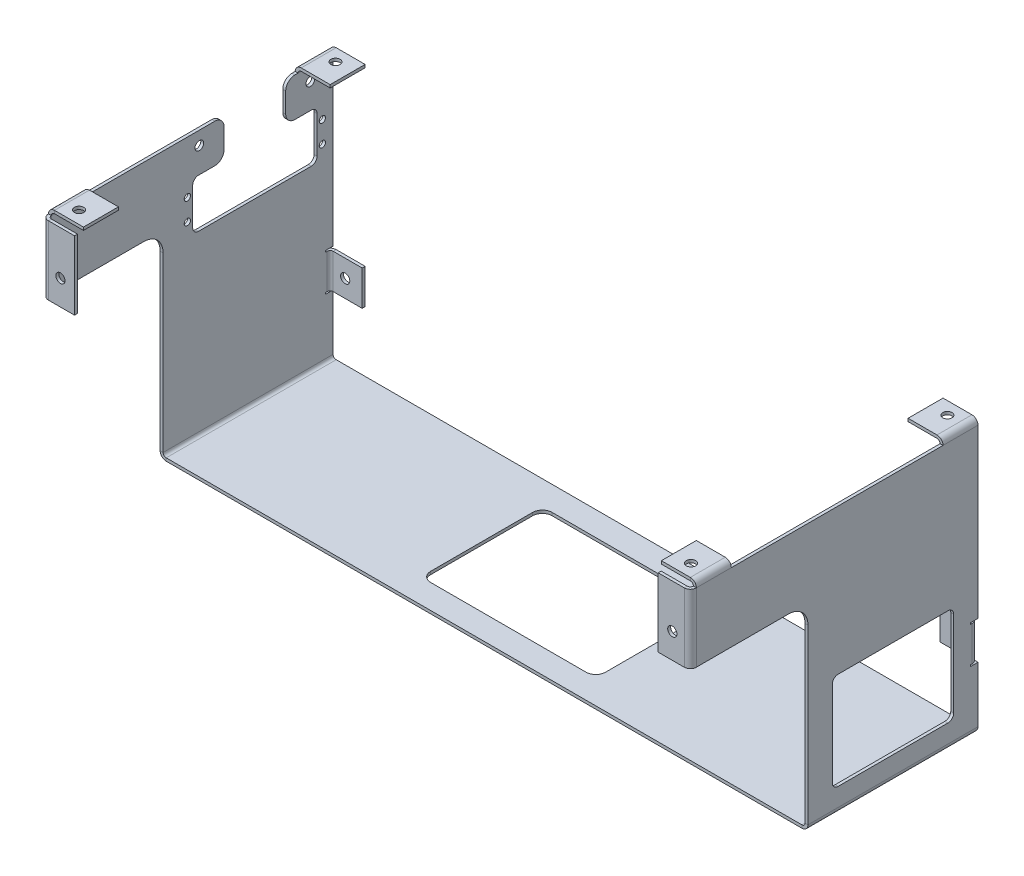
from build123d import *

# Parameters (mm, degrees)
BASE_FLANGE1_DEPTH              = 3.03784
EDGE_FLANGE2_DEPTH              = 175
EDGE_FLANGE3_STRIP_W            = 18.50136
EDGE_FLANGE3_STRIP_H            = 3.03784
EDGE_FLANGE3_STRIP_CUT_DEPTH    = 175
EDGE_FLANGE3_DEPTH              = 175
EDGE_FLANGE3_FLAT_DEPTH         = 3.03784
FILLET1_R                       = 20
EDGE_FLANGE6_STRIP_W            = 18.50136
EDGE_FLANGE6_STRIP_H            = 3.03784
EDGE_FLANGE6_STRIP_CUT_DEPTH    = 290
EDGE_FLANGE6_STRIP_2_W          = 18.50136
EDGE_FLANGE6_STRIP_2_H          = 3.03784
EDGE_FLANGE6_STRIP_CUT_2_DEPTH  = 290
EDGE_FLANGE6_DEPTH              = 290
EDGE_FLANGE6_BEND_DEPTH         = 290
SKETCH38_W                      = 218
SKETCH38_H                      = 6.21284
CUT_EXTRUDE1_DEPTH              = 778.569289517
EDGE_FLANGE7_STRIP_W            = 18.50136
EDGE_FLANGE7_STRIP_H            = 3.03784
EDGE_FLANGE7_STRIP_CUT_DEPTH    = 36
EDGE_FLANGE7_RELIEF_W           = 20.02028
EDGE_FLANGE7_RELIEF_H           = 1.51892
EDGE_FLANGE7_RELIEF_CUT_DEPTH   = 3.03784
EDGE_FLANGE7_STRIP_2_W          = 18.50136
EDGE_FLANGE7_STRIP_2_H          = 3.03784
EDGE_FLANGE7_STRIP_CUT_2_DEPTH  = 36
EDGE_FLANGE7_RELIEF_2_W         = 20.02028
EDGE_FLANGE7_RELIEF_2_H         = 1.51892
EDGE_FLANGE7_RELIEF_CUT_2_DEPTH = 3.03784
EDGE_FLANGE7_DEPTH              = 36
EDGE_FLANGE7_BEND_DEPTH         = 36
EDGE_FLANGE8_DEPTH              = 70.78716
EDGE_FLANGE8_BEND_DEPTH         = 70.78716
F_9_5_9_5_DIAMETER_HOLE1_D      = 9.5
F_9_5_9_5_DIAMETER_HOLE1_DEPTH  = 3.03784
F_9_5_9_5_DIAMETER_HOLE2_D      = 9.5
CUT_EXTRUDE2_DEPTH              = 778.31126101
M5_CLEARANCE_HOLE1_D            = 6.5
M5_CLEARANCE_HOLE1_DEPTH        = 3.03784
CUT_EXTRUDE3_REACH              = 781.908
F_9_5_9_5_DIAMETER_HOLE3_D      = 9.5
CUT_EXTRUDE4_DEPTH              = 779.440188529
CUT_EXTRUDE5_REACH              = 781.908
SKETCH62_W                      = 63.5
SKETCH62_H                      = 39.78716
FILLET2_R                       = 9.525
M8_CLEARANCE_HOLE1_D            = 9
M8_CLEARANCE_HOLE1_DEPTH        = 3.03784


# Sheet-metal steps are written as plain solids
with BuildPart() as part:
    # Sketch1 → Base-Flange1 (new body)
    with BuildSketch(Plane(origin=(0, 0, 0), x_dir=(0, 0, -1), z_dir=(1, 0, 0))):
        Polygon((-175, 198), (-290, 198), (-290, 275), (0, 275), (0, 0), (-175, 0), align=None)
    extrude(amount=-BASE_FLANGE1_DEPTH)

    # Edge-Flange2 section (across the edge) → Edge-Flange2 (add)
    with BuildSketch(Plane(origin=(0, -3.175, 175), x_dir=(0, 1, 0), z_dir=(0, 0, -1))):
        with BuildLine():
            Line((-3.03784, 3.175), (-3.03784, 663.96216))
            Line((-3.03784, 663.96216), (0, 663.96216))
            Line((0, 663.96216), (0, 3.175))
            ThreePointArc((0, 3.175), (0.92993597, 0.92993597), (3.175, 0))
            Line((3.175, 0), (3.175, -3.03784))
            ThreePointArc((3.175, -3.03784), (-1.218141294, -1.218141294), (-3.03784, 3.175))
        make_face()
    extrude(amount=EDGE_FLANGE2_DEPTH)

    # Edge-Flange3 strip (across the edge) → Edge-Flange3 strip cut (cut)
    with BuildSketch(Plane(origin=(663.96216, -3.175, 175), x_dir=(-1, 0, 0), z_dir=(0, 0, -1))):
        with Locations((-3.03784, -1.51892)):
            Rectangle(EDGE_FLANGE3_STRIP_W, EDGE_FLANGE3_STRIP_H)
    extrude(amount=EDGE_FLANGE3_STRIP_CUT_DEPTH, mode=Mode.SUBTRACT)

    # Edge-Flange3 bend section (across the edge) → Edge-Flange3 (add)
    with BuildSketch(Plane(origin=(663.96216, -3.175, 175), x_dir=(-1, 0, 0), z_dir=(0, 0, -1))):
        with BuildLine():
            Line((0, 3.175), (3.03784, 3.175))
            ThreePointArc((3.03784, 3.175), (3.96777597, 0.92993597), (6.21284, 0))
            Line((6.21284, 0), (6.21284, -3.03784))
            ThreePointArc((6.21284, -3.03784), (1.819698706, -1.218141294), (0, 3.175))
        make_face()
    extrude(amount=EDGE_FLANGE3_DEPTH)

    # Edge-Flange3 profile (on flange) → Edge-Flange3 flat (add)
    with BuildSketch(Plane(origin=(663.96216, -3.175, 0), x_dir=(0, 0, -1), z_dir=(1, 0, 0))):
        Polygon((0, 3.175), (0, 278.175), (-290, 278.175), (-290, 201.175), (-175, 201.175), (-175, 3.175), align=None)
    extrude(amount=-EDGE_FLANGE3_FLAT_DEPTH)

    # Fillet1
    fillet1_edges = [part.edges().sort_by_distance(p)[0] for p in [
        (-1.51892, 198, 175),
        (662.44324, 198, 175),
    ]]
    fillet(fillet1_edges, radius=FILLET1_R)

    # Edge-Flange6 strip (across the edge) → Edge-Flange6 strip cut (cut)
    with BuildSketch(Plane(origin=(0, 275, 0), x_dir=(0, -1, 0), z_dir=(0, 0, 1))):
        with Locations((-3.03784, -1.51892)):
            Rectangle(EDGE_FLANGE6_STRIP_W, EDGE_FLANGE6_STRIP_H)
    extrude(amount=EDGE_FLANGE6_STRIP_CUT_DEPTH, mode=Mode.SUBTRACT)

    # Edge-Flange6 strip 2 (across the edge) → Edge-Flange6 strip cut 2 (cut)
    with BuildSketch(Plane(origin=(660.92432, 275, 290), x_dir=(0, -1, 0), z_dir=(0, 0, -1))):
        with Locations((-3.03784, -1.51892)):
            Rectangle(EDGE_FLANGE6_STRIP_2_W, EDGE_FLANGE6_STRIP_2_H)
    extrude(amount=EDGE_FLANGE6_STRIP_CUT_2_DEPTH, mode=Mode.SUBTRACT)

    # Edge-Flange6 section (across the edge) → Edge-Flange6 (add)
    with BuildSketch(Plane(origin=(0, 275, 0), x_dir=(0, -1, 0), z_dir=(0, 0, 1))):
        with BuildLine():
            Line((0, 3.175), (0, 32.96216))
            Line((0, 32.96216), (3.03784, 32.96216))
            Line((3.03784, 32.96216), (3.03784, 3.175))
            ThreePointArc((3.03784, 3.175), (3.96777597, 0.92993597), (6.21284, 0))
            Line((6.21284, 0), (6.21284, -3.03784))
            ThreePointArc((6.21284, -3.03784), (1.819698706, -1.218141294), (0, 3.175))
        make_face()
    extrude(amount=EDGE_FLANGE6_DEPTH)

    # Edge-Flange6 section 2 (across the edge) → Edge-Flange6 bend (add)
    with BuildSketch(Plane(origin=(660.92432, 275, 290), x_dir=(0, -1, 0), z_dir=(0, 0, -1))):
        with BuildLine():
            Line((0, 3.175), (0, 32.96216))
            Line((0, 32.96216), (3.03784, 32.96216))
            Line((3.03784, 32.96216), (3.03784, 3.175))
            ThreePointArc((3.03784, 3.175), (3.96777597, 0.92993597), (6.21284, 0))
            Line((6.21284, 0), (6.21284, -3.03784))
            ThreePointArc((6.21284, -3.03784), (1.819698706, -1.218141294), (0, 3.175))
        make_face()
    extrude(amount=EDGE_FLANGE6_BEND_DEPTH)

    # Sketch38 → Cut-Extrude1 (cut, through all)
    with BuildSketch(Plane(origin=(663.96216, 0, 0), x_dir=(0, 0, -1), z_dir=(1, 0, 0))):
        with Locations((-145, 271.89358)):
            Rectangle(SKETCH38_W, SKETCH38_H)
    extrude(amount=-CUT_EXTRUDE1_DEPTH, mode=Mode.SUBTRACT)

    # Edge-Flange7 strip (across the edge) → Edge-Flange7 strip cut (cut)
    with BuildSketch(Plane.ZX.offset(59)):
        with Locations((-3.03784, -1.51892)):
            Rectangle(EDGE_FLANGE7_STRIP_W, EDGE_FLANGE7_STRIP_H)
    extrude(amount=EDGE_FLANGE7_STRIP_CUT_DEPTH, mode=Mode.SUBTRACT)

    # Edge-Flange7 relief (on the sheet) → Edge-Flange7 relief cut (cut)
    with BuildSketch(Plane(origin=(0, 59, 6.21284), x_dir=(0, 0, 1), z_dir=(1, 0, 0))):
        with Locations((-8.49122, 0.75946)):
            Rectangle(EDGE_FLANGE7_RELIEF_W, EDGE_FLANGE7_RELIEF_H)
        with Locations((-8.49122, -36.75946)):
            Rectangle(EDGE_FLANGE7_RELIEF_W, EDGE_FLANGE7_RELIEF_H)
    extrude(amount=-EDGE_FLANGE7_RELIEF_CUT_DEPTH, mode=Mode.SUBTRACT)

    # Edge-Flange7 strip 2 (across the edge) → Edge-Flange7 strip cut 2 (cut)
    with BuildSketch(Plane(origin=(660.92432, 95, 0), x_dir=(0, 0, 1), z_dir=(0, -1, 0))):
        with Locations((-3.03784, -1.51892)):
            Rectangle(EDGE_FLANGE7_STRIP_2_W, EDGE_FLANGE7_STRIP_2_H)
    extrude(amount=EDGE_FLANGE7_STRIP_CUT_2_DEPTH, mode=Mode.SUBTRACT)

    # Edge-Flange7 relief 2 (on the sheet) → Edge-Flange7 relief cut 2 (cut)
    with BuildSketch(Plane(origin=(660.92432, 95, 6.21284), x_dir=(0, 0, 1), z_dir=(-1, 0, 0))):
        with Locations((-8.49122, 0.75946)):
            Rectangle(EDGE_FLANGE7_RELIEF_2_W, EDGE_FLANGE7_RELIEF_2_H)
        with Locations((-8.49122, -36.75946)):
            Rectangle(EDGE_FLANGE7_RELIEF_2_W, EDGE_FLANGE7_RELIEF_2_H)
    extrude(amount=-EDGE_FLANGE7_RELIEF_CUT_2_DEPTH, mode=Mode.SUBTRACT)

    # Edge-Flange7 section (across the edge) → Edge-Flange7 (add)
    with BuildSketch(Plane.ZX.offset(59)):
        with BuildLine():
            Line((0, 3.175), (0, 32.96216))
            Line((0, 32.96216), (3.03784, 32.96216))
            Line((3.03784, 32.96216), (3.03784, 3.175))
            ThreePointArc((3.03784, 3.175), (3.96777597, 0.92993597), (6.21284, 0))
            Line((6.21284, 0), (6.21284, -3.03784))
            ThreePointArc((6.21284, -3.03784), (1.819698706, -1.218141294), (0, 3.175))
        make_face()
    extrude(amount=EDGE_FLANGE7_DEPTH)

    # Edge-Flange7 section 2 (across the edge) → Edge-Flange7 bend (add)
    with BuildSketch(Plane(origin=(660.92432, 95, 0), x_dir=(0, 0, 1), z_dir=(0, -1, 0))):
        with BuildLine():
            Line((0, 3.175), (0, 32.96216))
            Line((0, 32.96216), (3.03784, 32.96216))
            Line((3.03784, 32.96216), (3.03784, 3.175))
            ThreePointArc((3.03784, 3.175), (3.96777597, 0.92993597), (6.21284, 0))
            Line((6.21284, 0), (6.21284, -3.03784))
            ThreePointArc((6.21284, -3.03784), (1.819698706, -1.218141294), (0, 3.175))
        make_face()
    extrude(amount=EDGE_FLANGE7_BEND_DEPTH)

    # Edge-Flange8 section (across the edge) → Edge-Flange8 (add)
    with BuildSketch(Plane(origin=(0, 268.78716, 293.175), x_dir=(0, 0, -1), z_dir=(0, -1, 0))):
        with BuildLine():
            Line((-3.03784, 3.175), (-3.03784, 29.96216))
            Line((-3.03784, 29.96216), (0, 29.96216))
            Line((0, 29.96216), (0, 3.175))
            ThreePointArc((0, 3.175), (0.92993597, 0.92993597), (3.175, 0))
            Line((3.175, 0), (3.175, -3.03784))
            ThreePointArc((3.175, -3.03784), (-1.218141294, -1.218141294), (-3.03784, 3.175))
        make_face()
    extrude(amount=EDGE_FLANGE8_DEPTH)

    # Edge-Flange8 section 2 (across the edge) → Edge-Flange8 bend (add)
    with BuildSketch(Plane(origin=(660.92432, 198, 293.175), x_dir=(0, 0, -1), z_dir=(0, 1, 0))):
        with BuildLine():
            Line((-3.03784, 3.175), (-3.03784, 29.96216))
            Line((-3.03784, 29.96216), (0, 29.96216))
            Line((0, 29.96216), (0, 3.175))
            ThreePointArc((0, 3.175), (0.92993597, 0.92993597), (3.175, 0))
            Line((3.175, 0), (3.175, -3.03784))
            ThreePointArc((3.175, -3.03784), (-1.218141294, -1.218141294), (-3.03784, 3.175))
        make_face()
    extrude(amount=EDGE_FLANGE8_BEND_DEPTH)

    # Ø9.5 (9.5) Diameter Hole1
    with Locations(Plane(origin=(0, 275, 0), x_dir=(1, 0, 0), z_dir=(0, 1, 0))):
        with Locations((15.46216, -13), (15.46216, -277), (645.46216, -277), (645.46216, -13)):
            Hole(F_9_5_9_5_DIAMETER_HOLE1_D / 2, depth=F_9_5_9_5_DIAMETER_HOLE1_DEPTH)

    # Ø9.5 (9.5) Diameter Hole2 (through all)
    with Locations(Plane(origin=(0, 0, 0), x_dir=(-1, 0, 0), z_dir=(0, 0, -1))):
        with Locations((-645.46216, 77), (-15.46216, 77)):
            Hole(F_9_5_9_5_DIAMETER_HOLE2_D / 2)

    # Sketch49 → Cut-Extrude2 (cut, through all)
    with BuildSketch(Plane.ZY.offset(-660.92432)):
        with BuildLine():
            Line((144, 118.78716), (31, 118.78716))
            ThreePointArc((31, 118.78716), (26.757359313, 117.029800687), (25, 112.78716))
            Line((25, 112.78716), (25, 24.78716))
            ThreePointArc((25, 24.78716), (26.757359313, 20.544519313), (31, 18.78716))
            Line((31, 18.78716), (144, 18.78716))
            ThreePointArc((144, 18.78716), (148.242640687, 20.544519313), (150, 24.78716))
            Line((150, 24.78716), (150, 112.78716))
            ThreePointArc((150, 112.78716), (148.242640687, 117.029800687), (144, 118.78716))
        make_face()
    extrude(amount=-CUT_EXTRUDE2_DEPTH, mode=Mode.SUBTRACT)

    # M5 Clearance Hole1
    with Locations(Plane.ZY.offset(3.03784)):
        with Locations((11.05, 215), (11.05, 193), (150.05, 215), (150.05, 193)):
            Hole(M5_CLEARANCE_HOLE1_D / 2, depth=M5_CLEARANCE_HOLE1_DEPTH)

    # Sketch52 → Cut-Extrude3 (cut, up to next)
    with BuildSketch(Plane.ZY.offset(3.03784), mode=Mode.PRIVATE) as cut_extrude3_sk1:
        with BuildLine():
            Line((22.55, 229), (138.55, 229))
            ThreePointArc((138.55, 229), (142.792640687, 227.242640687), (144.55, 223))
            Line((144.55, 223), (144.55, 185))
            ThreePointArc((144.55, 185), (142.792640687, 180.757359313), (138.55, 179))
            Line((138.55, 179), (22.55, 179))
            ThreePointArc((22.55, 179), (18.307359313, 180.757359313), (16.55, 185))
            Line((16.55, 185), (16.55, 223))
            ThreePointArc((16.55, 223), (18.307359313, 227.242640687), (22.55, 229))
        make_face()
    cut_extrude3_tool1 = extrude(cut_extrude3_sk1.sketch, amount=-CUT_EXTRUDE3_REACH, mode=Mode.PRIVATE) & part.part
    add(cut_extrude3_tool1.solids().sort_by_distance((-3.03784, 204, 80.55))[0], mode=Mode.SUBTRACT)

    # Ø9.5 (9.5) Diameter Hole3 (through all)
    with Locations(Plane.XY.offset(296.21284)):
        with Locations((645.46216, 223.78716), (15.46216, 223.78716)):
            Hole(F_9_5_9_5_DIAMETER_HOLE3_D / 2)

    # Sketch61 → Cut-Extrude4 (cut, through all)
    with BuildSketch(Plane(origin=(0, -3.175, 0), x_dir=(1, 0, 0), z_dir=(0, 1, 0))):
        with BuildLine():
            Line((250.46216, -25), (410.46216, -25))
            ThreePointArc((410.46216, -25), (417.533227812, -27.928932188), (420.46216, -35))
            Line((420.46216, -35), (420.46216, -140))
            ThreePointArc((420.46216, -140), (417.533227812, -147.071067812), (410.46216, -150))
            Line((410.46216, -150), (250.46216, -150))
            ThreePointArc((250.46216, -150), (243.391092188, -147.071067812), (240.46216, -140))
            Line((240.46216, -140), (240.46216, -35))
            ThreePointArc((240.46216, -35), (243.391092188, -27.928932188), (250.46216, -25))
        make_face()
    extrude(amount=-CUT_EXTRUDE4_DEPTH, mode=Mode.SUBTRACT)

    # Sketch62 → Cut-Extrude5 (cut, up to next)
    with BuildSketch(Plane.ZY.offset(3.03784), mode=Mode.PRIVATE) as cut_extrude5_sk1:
        with Locations((80.55, 248.89358)):
            Rectangle(SKETCH62_W, SKETCH62_H)
    cut_extrude5_tool1 = extrude(cut_extrude5_sk1.sketch, amount=-CUT_EXTRUDE5_REACH, mode=Mode.PRIVATE) & part.part
    add(cut_extrude5_tool1.solids().sort_by_distance((-3.03784, 248.89358, 80.55))[0], mode=Mode.SUBTRACT)

    # Fillet2
    fillet2_edges = [part.edges().sort_by_distance(p)[0] for p in [
        (-1.51892, 268.78716, 48.8),
        (-1.51892, 268.78716, 112.3),
        (-1.51892, 229, 112.3),
        (-1.51892, 229, 48.8),
    ]]
    fillet(fillet2_edges, radius=FILLET2_R)

    # M8 Clearance Hole1
    with Locations(Plane.ZY.offset(3.03784)):
        with Locations((23.4, 255.05), (137.7, 255.05)):
            Hole(M8_CLEARANCE_HOLE1_D / 2, depth=M8_CLEARANCE_HOLE1_DEPTH)


solid = part.part
